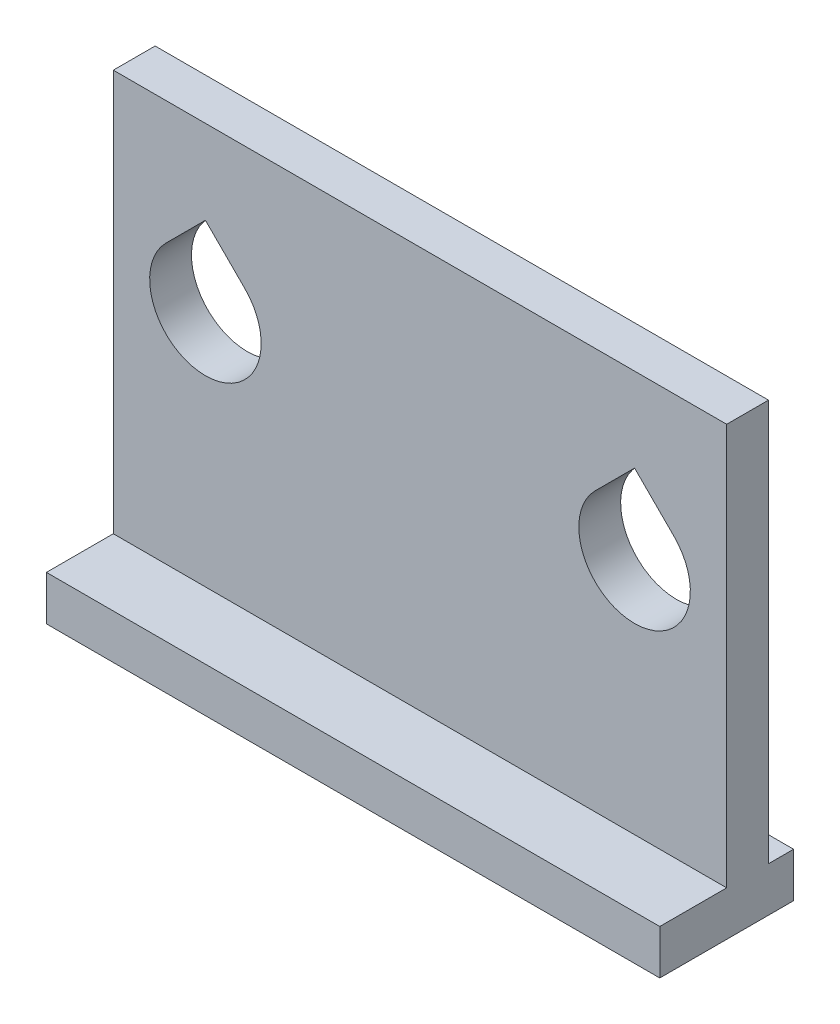
from build123d import *

# Parameters (mm, degrees)
SKETCH1_W                = 110
SKETCH1_H                = 80
BOSS_EXTRUDE1_DEPTH      = 7.5
BOSS_EXTRUDE2_DEPTH      = 12
BOSS_EXTRUDE2_DEPTH_BACK = 12
SKETCH3_W                = 110
SKETCH3_H                = 8


with BuildPart() as part:
    # Sketch1 → Boss-Extrude1 (new body)
    with BuildSketch(Plane.XY):
        with Locations((0, 40)):
            Rectangle(SKETCH1_W, SKETCH1_H)
        with BuildLine():
            ThreePointArc((-28.481, 50.8), (-42.307834324, 41.561204675), (-45.552067812, 57.871067812))
            Line((-45.552067812, 57.871067812), (-38.481, 64.942135624))
            Line((-38.481, 64.942135624), (-31.409932188, 57.871067812))
            ThreePointArc((-31.409932188, 57.871067812), (-29.242204675, 54.626834324), (-28.481, 50.8))
        make_face(mode=Mode.SUBTRACT)
        with BuildLine():
            ThreePointArc((28.481, 50.8), (29.242204675, 54.626834324), (31.409932188, 57.871067812))
            Line((31.409932188, 57.871067812), (38.481, 64.942135624))
            Line((38.481, 64.942135624), (45.552067812, 57.871067812))
            ThreePointArc((45.552067812, 57.871067812), (47.719795325, 54.626834324), (48.481, 50.8))
            ThreePointArc((48.481, 50.8), (38.481, 40.8), (28.481, 50.8))
        make_face(mode=Mode.SUBTRACT)
    extrude(amount=BOSS_EXTRUDE1_DEPTH)

    # Sketch3 → Boss-Extrude2 (add, two sides: drawn at the far end of the back side and taken through both)
    with BuildSketch(Plane.XY.offset(7.5).offset(-BOSS_EXTRUDE2_DEPTH_BACK)):
        with Locations((0, 4)):
            Rectangle(SKETCH3_W, SKETCH3_H)
    extrude(amount=BOSS_EXTRUDE2_DEPTH + BOSS_EXTRUDE2_DEPTH_BACK)


solid = part.part
